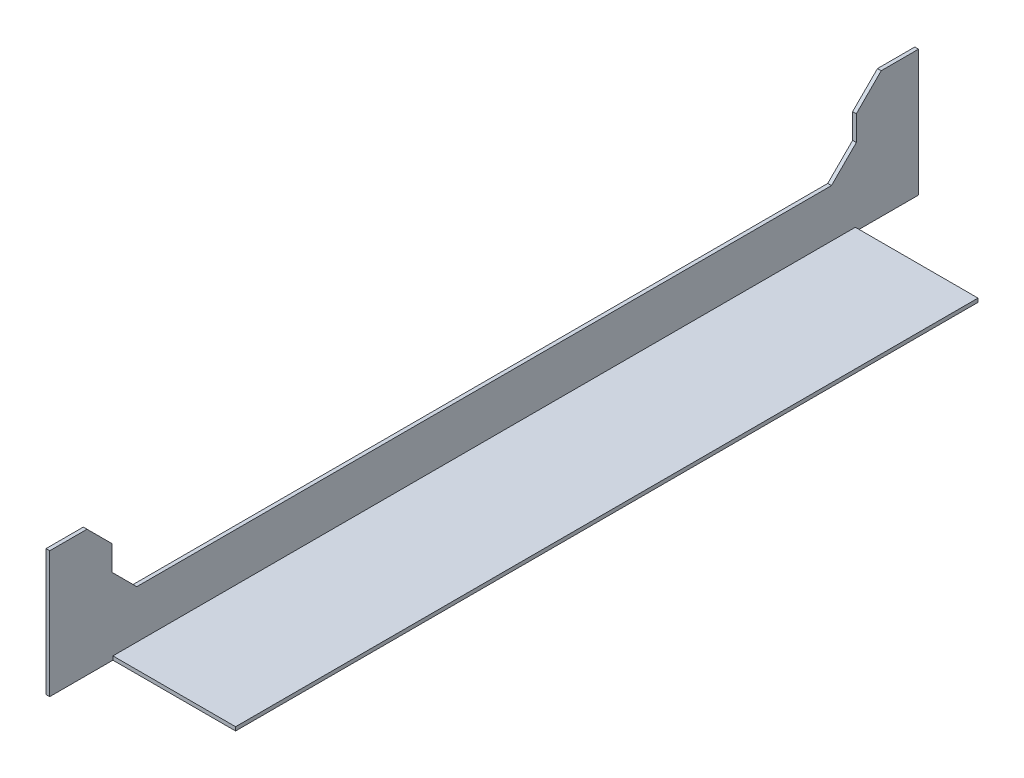
from build123d import *

# Parameters (mm, degrees)
SALIENTE_EXTRUIR1_DEPTH = 349.2
CROQUIS2_R              = 4
CORTAR_EXTRUIR1_DEPTH   = 2
CROQUIS4_W              = 49.3
CROQUIS4_H              = 25.4
CORTAR_EXTRUIR2_DEPTH   = 2
CROQUIS5_W              = 299.2
CROQUIS5_H              = 30
CORTAR_EXTRUIR3_DEPTH   = 2
CHAFL_N1_SIZE           = 10


with BuildPart() as part:
    # Croquis1 → Saliente-Extruir1 (new body)
    with BuildSketch(Plane.XY):
        Polygon((0, 0), (0, 50.8), (1.5, 50.8), (1.5, 1.5), (50.8, 1.5), (50.8, 0), align=None)
    extrude(amount=SALIENTE_EXTRUIR1_DEPTH)

    # Croquis2 → Cortar-Extruir1 (cut)
    with BuildSketch(Plane.ZY):
        with Locations((126.6, 25.4)):
            Circle(CROQUIS2_R)
        with Locations((222.6, 25.4)):
            Circle(CROQUIS2_R)
        with Locations((30.6, 25.4)):
            Circle(CROQUIS2_R)
        with Locations((318.6, 25.4)):
            Circle(CROQUIS2_R)
    extrude(amount=-CORTAR_EXTRUIR1_DEPTH, mode=Mode.SUBTRACT)

    # Croquis4 → Cortar-Extruir2 (cut)
    with BuildSketch(Plane(origin=(0, 1.5, 0), x_dir=(1, 0, 0), z_dir=(0, 1, 0))):
        with Locations((26.15, -12.7)):
            Rectangle(CROQUIS4_W, CROQUIS4_H)
        with Locations((26.15, -336.5)):
            Rectangle(CROQUIS4_W, CROQUIS4_H)
    extrude(amount=-CORTAR_EXTRUIR2_DEPTH, mode=Mode.SUBTRACT)

    # Croquis5 → Cortar-Extruir3 (cut)
    with BuildSketch(Plane.ZY):
        with Locations((174.6, 35.8)):
            Rectangle(CROQUIS5_W, CROQUIS5_H)
    extrude(amount=-CORTAR_EXTRUIR3_DEPTH, mode=Mode.SUBTRACT)

    # Chaflán1
    chafl_n1_edges = [part.edges().sort_by_distance(p)[0] for p in [
        (0.75, 50.8, 25),
        (0.75, 20.8, 25),
        (0.75, 50.8, 324.2),
        (0.75, 20.8, 324.2),
    ]]
    chamfer(chafl_n1_edges, length=CHAFL_N1_SIZE)


solid = part.part
